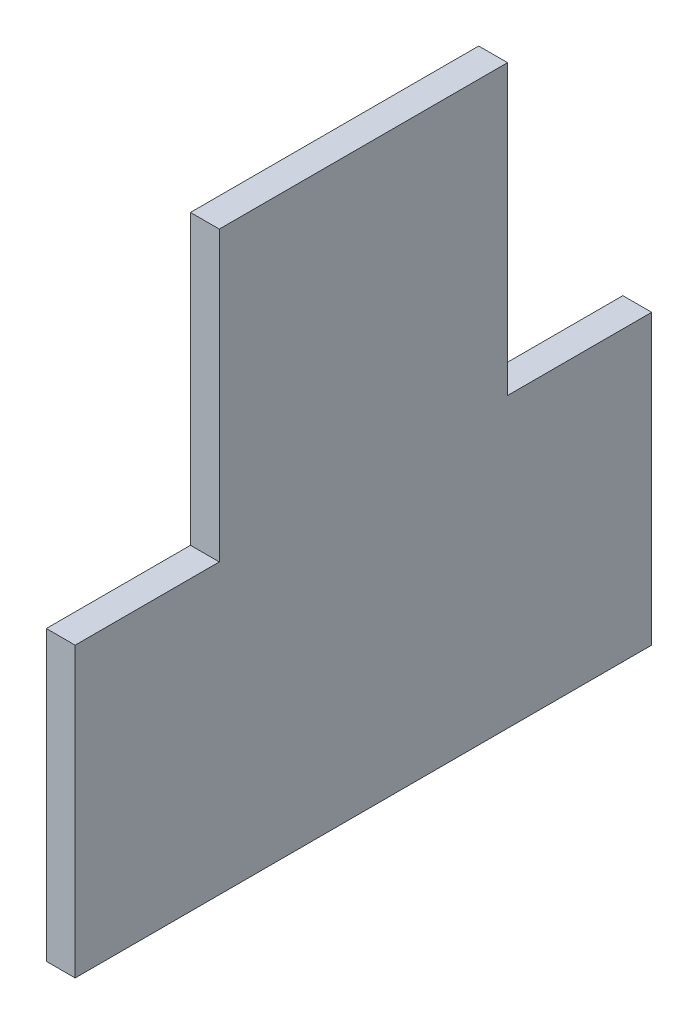
from build123d import *

# Parameters (mm, degrees)
SKETCH1_W           = 12.7
SKETCH1_H           = 152.4
BOSS_EXTRUDE1_DEPTH = 25.4
SKETCH6_W           = 50.8
SKETCH6_H           = 25.4
BOSS_EXTRUDE5_DEPTH = 2.54
SKETCH7_W           = 2.54
SKETCH7_H           = 25.4
BOSS_EXTRUDE6_DEPTH = 25.4
SKETCH11_W          = 12.7
SKETCH11_H          = 25.4
CUT_EXTRUDE1_DEPTH  = 162.364982571


with BuildPart() as part:
    # Sketch1 → Boss-Extrude1 (new body)
    with BuildSketch(Plane(origin=(0, 0, 0), x_dir=(1, 0, 0), z_dir=(0, 1, 0))):
        with Locations((6.35, 76.2)):
            Rectangle(SKETCH1_W, SKETCH1_H)
    extrude(amount=BOSS_EXTRUDE1_DEPTH)

    # Sketch6 → Boss-Extrude5 (add)
    with BuildSketch(Plane(origin=(12.7, 0, 0), x_dir=(0, 0, -1), z_dir=(1, 0, 0))):
        with Locations((127, 12.7)):
            Rectangle(SKETCH6_W, SKETCH6_H)
    extrude(amount=BOSS_EXTRUDE5_DEPTH)

    # Sketch7 → Boss-Extrude6 (add)
    with BuildSketch(Plane(origin=(0, 25.4, 0), x_dir=(1, 0, 0), z_dir=(0, 1, 0))):
        with Locations((13.97, 127)):
            Rectangle(SKETCH7_W, SKETCH7_H)
    extrude(amount=BOSS_EXTRUDE6_DEPTH)

    # Sketch11 → Cut-Extrude1 (cut, through all)
    with BuildSketch(Plane.XY):
        with Locations((6.35, 12.7)):
            Rectangle(SKETCH11_W, SKETCH11_H)
    extrude(amount=-CUT_EXTRUDE1_DEPTH, mode=Mode.SUBTRACT)


solid = part.part
